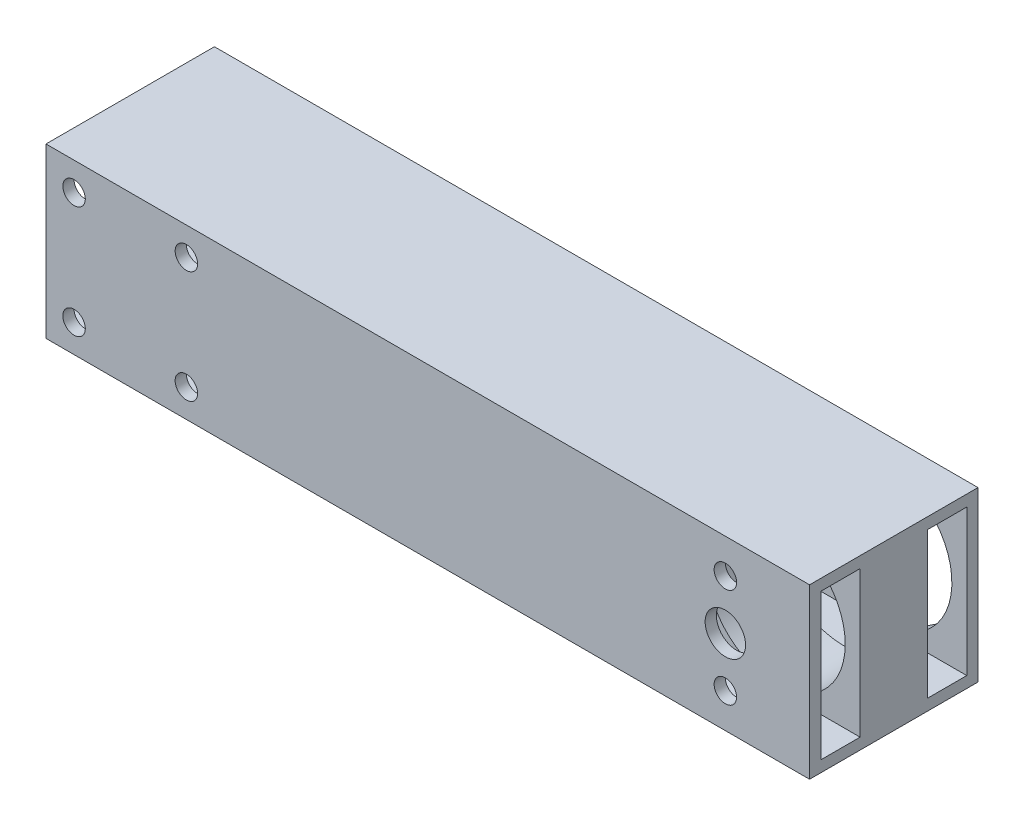
from build123d import *

# Parameters (mm, degrees)
BOSS_EXTRUDE3_DEPTH      = 90
BOSS_EXTRUDE3_DEPTH_BACK = 46
SKETCH1_W                = 30
SKETCH1_H                = 30
SKETCH1_W_2              = 7
SKETCH1_H_2              = 26
SKETCH6_R                = 12.35
CUT_EXTRUDE5_DEPTH       = 23
SKETCH8_R                = 3.6
SKETCH8_R_2              = 2
CUT_EXTRUDE6_DEPTH       = 17
SKETCH9_W                = 12
SKETCH9_H                = 26
CUT_EXTRUDE7_DEPTH       = 106
SKETCH12_R               = 2
CUT_EXTRUDE8_DEPTH       = 40


with BuildPart() as part:
    # Sketch1 → Boss-Extrude3 (new, two sides: drawn at the far end of the back side and taken through both)
    with BuildSketch(Plane(origin=(0, 0, 0), x_dir=(0, 0, -1), z_dir=(1, 0, 0)).offset(-BOSS_EXTRUDE3_DEPTH_BACK)):
        Rectangle(SKETCH1_W, SKETCH1_H)
        with Locations((-9.5, 0)):
            Rectangle(SKETCH1_W_2, SKETCH1_H_2, mode=Mode.SUBTRACT)
        with Locations((9.5, 0)):
            Rectangle(SKETCH1_W_2, SKETCH1_H_2, mode=Mode.SUBTRACT)
    extrude(amount=BOSS_EXTRUDE3_DEPTH + BOSS_EXTRUDE3_DEPTH_BACK)

    # Sketch6 → Cut-Extrude5 (cut)
    with BuildSketch(Plane(origin=(0, 0, -15), x_dir=(-1, 0, 0), z_dir=(0, 0, -1))):
        with Locations((-75, 0)):
            Circle(SKETCH6_R)
    extrude(amount=-CUT_EXTRUDE5_DEPTH, mode=Mode.SUBTRACT)

    # Sketch8 → Cut-Extrude6 (cut)
    with BuildSketch(Plane.XY.offset(15)):
        with Locations((75, 0)):
            Circle(SKETCH8_R)
        with Locations((75, 8.85)):
            Circle(SKETCH8_R_2)
        with Locations((75, -8.85)):
            Circle(SKETCH8_R_2)
    extrude(amount=-CUT_EXTRUDE6_DEPTH, mode=Mode.SUBTRACT)

    # Sketch9 → Cut-Extrude7 (cut)
    with BuildSketch(Plane.ZY.offset(46)):
        Rectangle(SKETCH9_W, SKETCH9_H)
    extrude(amount=-CUT_EXTRUDE7_DEPTH, mode=Mode.SUBTRACT)

    # Sketch12 → Cut-Extrude8 (cut)
    with BuildSketch(Plane.XY.offset(15)):
        with Locations((-41, 10)):
            Circle(SKETCH12_R)
        with Locations((-21, 10)):
            Circle(SKETCH12_R)
        with Locations((-21, -10)):
            Circle(SKETCH12_R)
        with Locations((-41, -10)):
            Circle(SKETCH12_R)
    extrude(amount=-CUT_EXTRUDE8_DEPTH, mode=Mode.SUBTRACT)


solid = part.part
